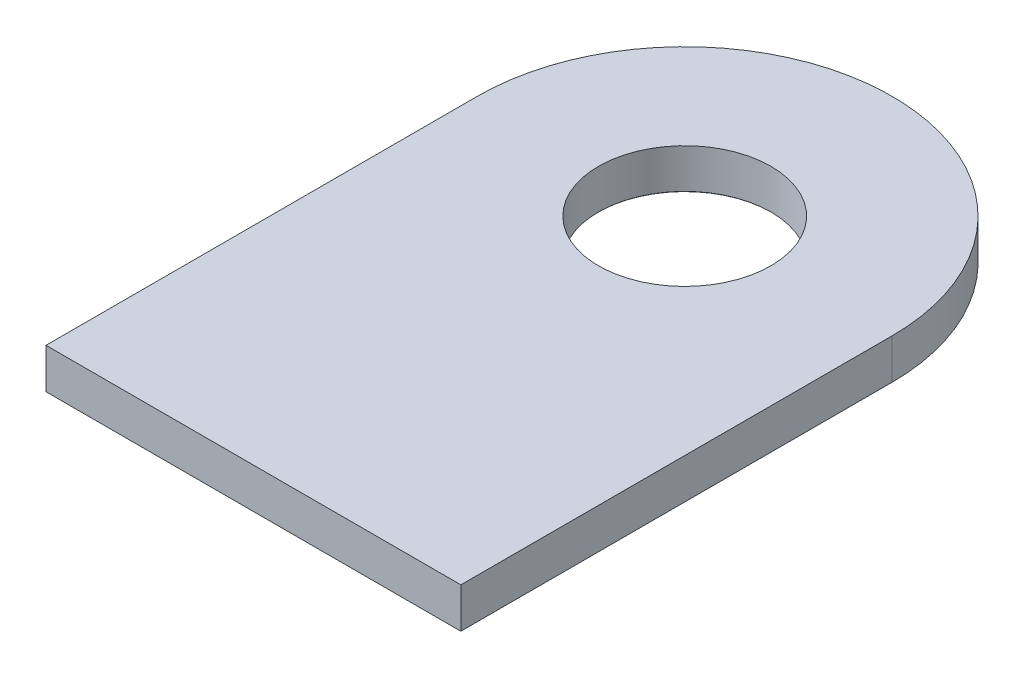
from build123d import *

# Parameters (mm, degrees)
BOSS_EXTRUDE1_DEPTH = 1.54


with BuildPart() as part:
    # Sketch1 → Boss-Extrude1 (new body)
    with BuildSketch(Plane(origin=(0, 0, 0), x_dir=(1, 0, 0), z_dir=(0, 1, 0))):
        with BuildLine():
            Line((7.94, -16.51), (7.94, 0))
            ThreePointArc((7.94, 0), (0, 7.94), (-7.94, 0))
            Line((-7.94, 0), (-7.94, -16.51))
            Line((-7.94, -16.51), (7.94, -16.51))
        make_face()
    extrude(amount=BOSS_EXTRUDE1_DEPTH)

    # Sketch3 → M6 Clearance Hole1 (revolve, cut)
    with BuildSketch(Plane(origin=(0, 0, 0), x_dir=(0, 0, -1), z_dir=(1, 0, 0))):
        Polygon((0, 0), (0, 1.54), (3.3, 1.54), (3.3, 0.025), (3.325, 0), align=None)
    revolve(axis=Axis((0, -6.35, 0), (0, 1, 0)), mode=Mode.SUBTRACT)


solid = part.part
